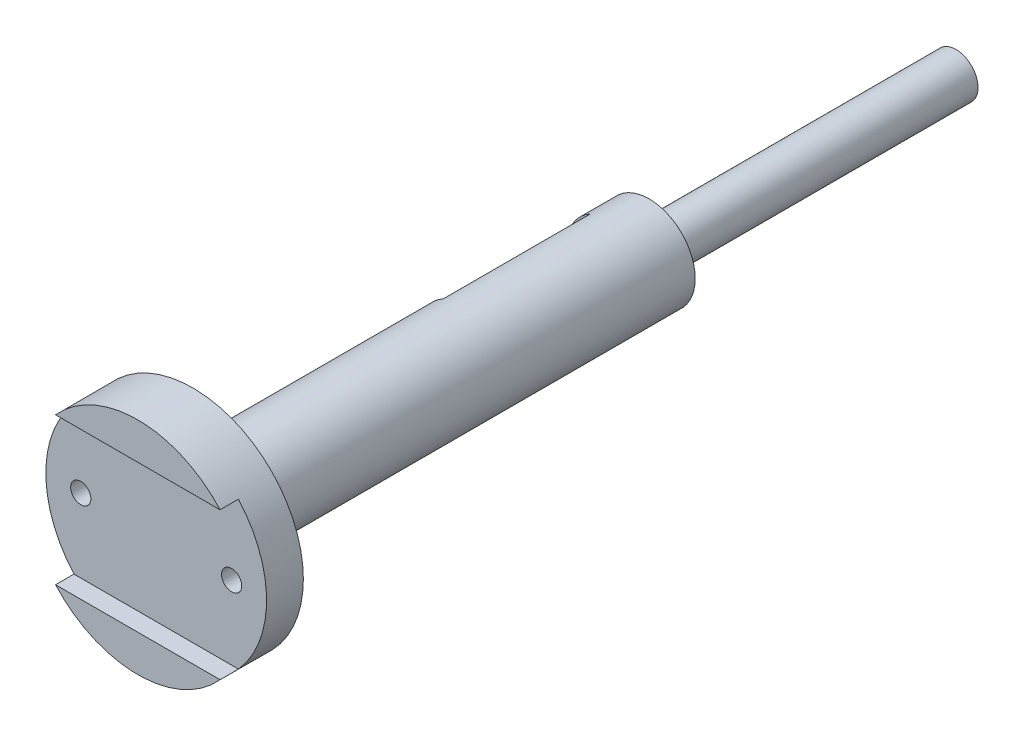
from build123d import *

# Parameters (mm, degrees)
ESQUISSE1_R                                = 30
BOSS_EXTRU_1_DEPTH                         = 15
ESQUISSE2_R                                = 12.5
BOSS_EXTRU_2_DEPTH                         = 124
ESQUISSE4_2_W                              = 230
ESQUISSE4_2_H                              = 40
ENL_V_MAT_EXTRU_1_DEPTH                    = 5
CHAMBRAGE_POUR_VIS_T_TE_HEXAGONALE_2_COUNT = 2
CHAMBRAGE_POUR_VIS_T_TE_HEXAGONALE_2_PITCH = 41
ESQUISSE17_R                               = 6
BOSS_EXTRU_4_DEPTH                         = 83.38
ESQUISSE18_W                               = 10.356322474
ESQUISSE18_H                               = 3
ENL_V_MAT_EXTRU_2_DEPTH                    = 3
ESQUISSE19_W                               = 7.933443835
ESQUISSE19_H                               = 21.9317122
ENL_V_MAT_EXTRU_3_DEPTH                    = 50
BOSS_EXTRU_6_START                         = -10
ESQUISSE21_R                               = 12.5
BOSS_EXTRU_6_DEPTH                         = 10
D_GAGEMENT_M41_D                           = 4.5
D_GAGEMENT_M41_DEPTH                       = 3
D_GAGEMENT_M41_TIP                         = 1.299038106


with BuildPart() as part:
    # Esquisse1 → Boss.-Extru.1 (new body)
    with BuildSketch(Plane.XY):
        Circle(ESQUISSE1_R)
    extrude(amount=BOSS_EXTRU_1_DEPTH)

    # Esquisse2 → Boss.-Extru.2 (add)
    with BuildSketch(Plane(origin=(0, 0, 0), x_dir=(-1, 0, 0), z_dir=(0, 0, -1))):
        Circle(ESQUISSE2_R)
    extrude(amount=BOSS_EXTRU_2_DEPTH)

    # Esquisse4<2> → Enlèv. mat.-Extru.1 (cut)
    with BuildSketch(Plane.XY.offset(15)):
        Rectangle(ESQUISSE4_2_W, ESQUISSE4_2_H)
    extrude(amount=-ENL_V_MAT_EXTRU_1_DEPTH, mode=Mode.SUBTRACT)

    # Esquisse14 → Chambrage pour vis à tête hexagonale M51 (revolve, cut)
    with BuildSketch(Plane.YZ.offset(-20.5)):
        Polygon((0, 0), (0, 15), (2.75, 15), (2.75, 3.605), (2.775, 3.58), (6.12, 3.58), (6.12, 0), align=None)
    chambrage_pour_vis_t_te_hexagonale_m51 = revolve(axis=Axis((-20.5, 0, -6.35), (0, 0, 1)), mode=Mode.SUBTRACT)

    # Chambrage pour vis _ t_te hexagonale 2: Chambrage pour vis à tête hexagonale M51 ×2
    with Locations(*[(i * CHAMBRAGE_POUR_VIS_T_TE_HEXAGONALE_2_PITCH, 0, 0) for i in range(1, CHAMBRAGE_POUR_VIS_T_TE_HEXAGONALE_2_COUNT)]):
        add(chambrage_pour_vis_t_te_hexagonale_m51, mode=Mode.SUBTRACT)

    # Esquisse17 → Boss.-Extru.4 (add)
    with BuildSketch(Plane(origin=(0, 0, -124), x_dir=(-1, 0, 0), z_dir=(0, 0, -1))):
        Circle(ESQUISSE17_R)
    extrude(amount=BOSS_EXTRU_4_DEPTH)

    # Esquisse18 → Enlèv. mat.-Extru.2 (cut)
    with BuildSketch(Plane(origin=(0, 0, -207.38), x_dir=(-1, 0, 0), z_dir=(0, 0, -1))):
        with Locations((1.787207702, 0)):
            Rectangle(ESQUISSE18_W, ESQUISSE18_H)
    extrude(amount=-ENL_V_MAT_EXTRU_2_DEPTH, mode=Mode.SUBTRACT)

    # Esquisse19 → Enlèv. mat.-Extru.3 (cut)
    with BuildSketch(Plane(origin=(0, 0, -124), x_dir=(-1, 0, 0), z_dir=(0, 0, -1))):
        with Locations((9.966721917, 0)):
            Rectangle(ESQUISSE19_W, ESQUISSE19_H)
    extrude(amount=-ENL_V_MAT_EXTRU_3_DEPTH, mode=Mode.SUBTRACT)

    # Esquisse21 → Boss.-Extru.6 (add)
    with BuildSketch(Plane(origin=(0, 0, -124), x_dir=(-1, 0, 0), z_dir=(0, 0, -1)).offset(BOSS_EXTRU_6_START)):
        Circle(ESQUISSE21_R)
    extrude(amount=BOSS_EXTRU_6_DEPTH)

    # Dégagement M41
    with Locations(Plane.ZY.offset(6)):
        with Locations((-82.1, 5.85067254), (-93.1, -2.14932746), (-93.1, 5.85067254), (-104.1, 5.85067254)):
            Hole(D_GAGEMENT_M41_D / 2, depth=D_GAGEMENT_M41_DEPTH)
            with Locations((0, 0, -(D_GAGEMENT_M41_DEPTH + D_GAGEMENT_M41_TIP / 2))):  # 120° drill point
                Cone(0, D_GAGEMENT_M41_D / 2, D_GAGEMENT_M41_TIP, mode=Mode.SUBTRACT)


solid = part.part
